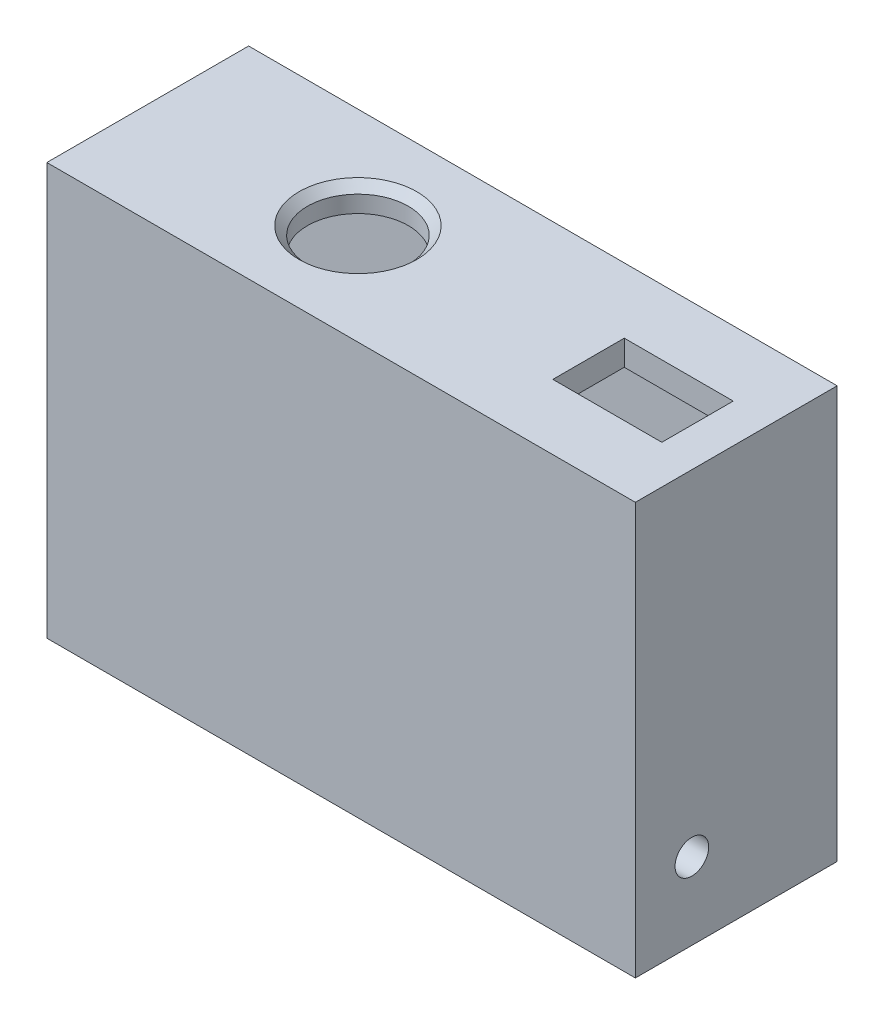
from build123d import *

# Parameters (mm, degrees)
SKETCH1_R               = 3
SKETCH1_W               = 6.481068034
SKETCH1_H               = 4.246177752
BOSS_EXTRUDE1_DEPTH     = 1.5
SKETCH2_W               = 35
SKETCH2_H               = 12
SKETCH2_W_2             = 32
SKETCH2_H_2             = 9
BOSS_EXTRUDE2_DEPTH     = 23
CHAMFER1_SIZE           = 0.5
CUT_EXTRUDE1_DEPTH      = 43.308391603
CUT_EXTRUDE1_DEPTH_BACK = 43.308391603
SKETCH3_R               = 1


with BuildPart() as part:
    # Sketch1 → Boss-Extrude1 (new body)
    with BuildSketch(Plane(origin=(0, 0, 0), x_dir=(1, 0, 0), z_dir=(0, 1, 0))):
        Polygon((12.5, 6), (22.5, 6), (22.5, -6), (12.5, -6), (-12.5, -6), (-12.5, 6), align=None)
        Circle(SKETCH1_R, mode=Mode.SUBTRACT)
        with Locations((16.956437287, 0)):
            Rectangle(SKETCH1_W, SKETCH1_H, mode=Mode.SUBTRACT)
    extrude(amount=BOSS_EXTRUDE1_DEPTH)

    # Sketch2 → Boss-Extrude2 (add)
    with BuildSketch(Plane(origin=(0, 0, 0), x_dir=(1, 0, 0), z_dir=(0, 1, 0))):
        with Locations((5, 0)):
            Rectangle(SKETCH2_W, SKETCH2_H)
        with Locations((5, 0)):
            Rectangle(SKETCH2_W_2, SKETCH2_H_2, mode=Mode.SUBTRACT)
    extrude(amount=-BOSS_EXTRUDE2_DEPTH)

    # Chamfer1
    chamfer1_edges = [part.edges().sort_by_distance(p)[0] for p in [
        (-3, 1.5, 0),
    ]]
    chamfer(chamfer1_edges, length=CHAMFER1_SIZE)

    # Sketch3 → Cut-Extrude1 (cut, two sides: drawn at the far end of the back side and taken through both)
    with BuildSketch(Plane.ZY.offset(12.5).offset(-CUT_EXTRUDE1_DEPTH_BACK)):
        with Locations((2.641237626, -18.430835776)):
            Circle(SKETCH3_R)
    extrude(amount=CUT_EXTRUDE1_DEPTH + CUT_EXTRUDE1_DEPTH_BACK, mode=Mode.SUBTRACT)


solid = part.part
